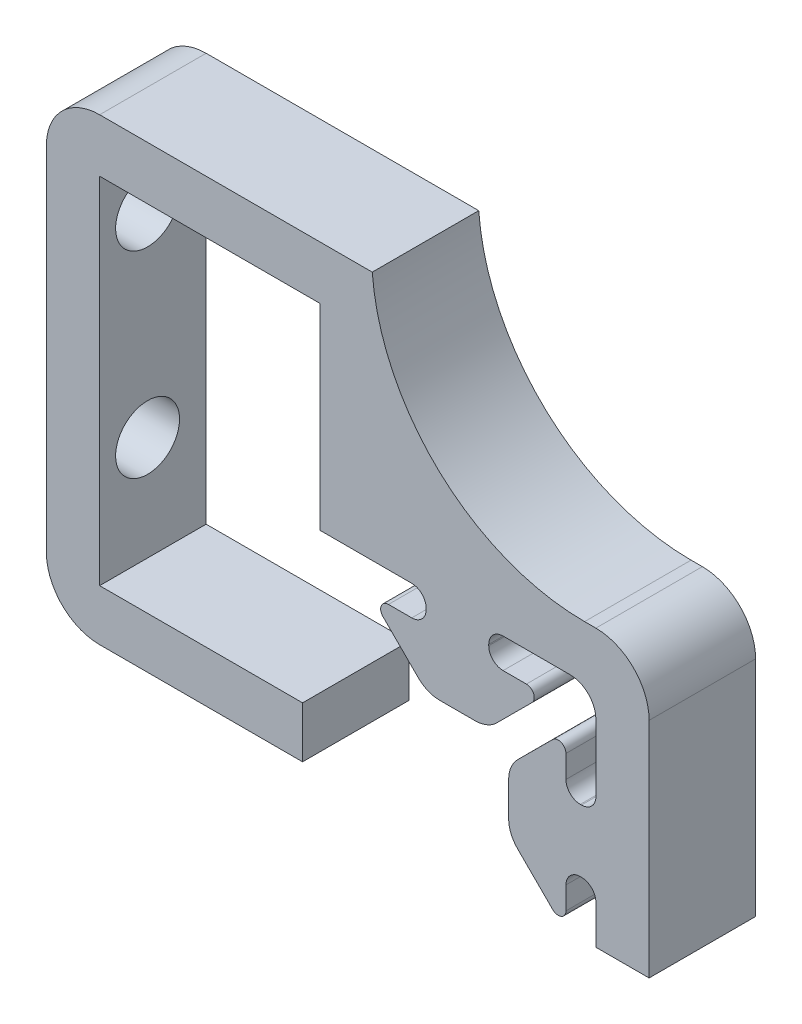
from build123d import *

# Parameters (mm, degrees)
BOSS_EXTRUDE1_DEPTH = 10
CUT_EXTRUDE1_REACH  = 70.061
SKETCH2_R           = 3
FILLET1_R           = 20
FILLET2_R           = 5
SKETCH3_W           = 29.852045942
SKETCH3_H           = 84.66747525
CUT_EXTRUDE2_DEPTH  = 125


with BuildPart() as part:
    # Sketch1 → Boss-Extrude1 (new body)
    with BuildSketch(Plane.XY):
        with BuildLine():
            Line((13, -5.3170836), (13, -7.9544418))
            Line((13, -7.9544418), (18, -7.9544418))
            Line((18, -7.9544418), (18, 18))
            Line((18, 18), (-8, 18))
            Line((-8, 18), (-8, 36.4526666))
            Line((-8, 36.4526666), (-38.6, 36.4526666))
            Line((-38.6, 36.4526666), (-38.6, -6.6473334))
            Line((-38.6, -6.6473334), (-18, -6.6473334))
            Line((-18, -6.6473334), (-14.542097223, -6.6473334))
            Line((-14.542097223, -6.6473334), (-14.542097223, -1.8473334))
            Line((-14.542097223, -1.8473334), (-33.6, -1.8473334))
            Line((-33.6, -1.8473334), (-33.6, 31.4526666))
            Line((-33.6, 31.4526666), (-12.9, 31.4526666))
            Line((-12.9, 31.4526666), (-12.9, 13))
            Line((-12.9, 13), (-4.305880552, 13))
            Line((-4.305880552, 13), (-4.287512407, 13))
            ThreePointArc((-4.287512407, 13), (-3.333616586, 12.604883414), (-2.9385, 11.650987593))
            Line((-2.9385, 11.650987593), (-2.9385, 11.539212407))
            ThreePointArc((-2.9385, 11.539212407), (-3.333616586, 10.585316586), (-4.287512407, 10.1902))
            Line((-4.287512407, 10.1902), (-6.476788598, 10.1902))
            ThreePointArc((-6.476788598, 10.1902), (-7.154992901, 9.736757749), (-6.995146796, 8.93674514))
            Line((-6.995146796, 8.93674514), (-3.686383353, 5.635543623))
            ThreePointArc((-3.686383353, 5.635543623), (-2.754473742, 5.014017446), (-1.655778399, 4.7958))
            Line((-1.655778399, 4.7958), (1.655778399, 4.7958))
            ThreePointArc((1.655778399, 4.7958), (2.754473742, 5.014017446), (3.686383353, 5.635543623))
            Line((3.686383353, 5.635543623), (6.995146796, 8.93674514))
            ThreePointArc((6.995146796, 8.93674514), (7.154992901, 9.736757749), (6.476788598, 10.1902))
            Line((6.476788598, 10.1902), (4.287512407, 10.1902))
            ThreePointArc((4.287512407, 10.1902), (3.333616586, 10.585316586), (2.9385, 11.539212407))
            Line((2.9385, 11.539212407), (2.9385, 11.650987593))
            ThreePointArc((2.9385, 11.650987593), (3.333616586, 12.604883414), (4.287512407, 13))
            Line((4.287512407, 13), (5.321597603, 13))
            Line((5.321597603, 13), (10.5918, 13))
            ThreePointArc((10.5918, 13), (12.29465455, 12.29465455), (13, 10.5918))
            Line((13, 10.5918), (13, 7.9544418))
            Line((13, 7.9544418), (13, 5.3170836))
            Line((13, 5.3170836), (13, 4.287469289))
            ThreePointArc((13, 4.287469289), (12.604883414, 3.333573468), (11.650987593, 2.938456882))
            Line((11.650987593, 2.938456882), (11.539212407, 2.938456882))
            ThreePointArc((11.539212407, 2.938456882), (10.585316586, 3.333573468), (10.1902, 4.287469289))
            Line((10.1902, 4.287469289), (10.1902, 6.402089023))
            ThreePointArc((10.1902, 6.402089023), (9.74154152, 7.073969797), (8.94902056, 6.917034355))
            Line((8.94902056, 6.917034355), (5.652895046, 3.628441884))
            ThreePointArc((5.652895046, 3.628441884), (5.027976112, 2.694919539), (4.8085, 1.593185507))
            Line((4.8085, 1.593185507), (4.8085, -1.593185507))
            ThreePointArc((4.8085, -1.593185507), (5.027976112, -2.694919539), (5.652895046, -3.628441884))
            Line((5.652895046, -3.628441884), (8.94902056, -6.917034355))
            ThreePointArc((8.94902056, -6.917034355), (9.74154152, -7.073969797), (10.1902, -6.402089023))
            Line((10.1902, -6.402089023), (10.1902, -4.287469289))
            ThreePointArc((10.1902, -4.287469289), (10.585316586, -3.333573468), (11.539212407, -2.938456882))
            Line((11.539212407, -2.938456882), (11.650987593, -2.938456882))
            ThreePointArc((11.650987593, -2.938456882), (12.604883414, -3.333573468), (13, -4.287469289))
            Line((13, -4.287469289), (13, -5.3170836))
        make_face()
    extrude(amount=BOSS_EXTRUDE1_DEPTH)

    # Sketch2 → Cut-Extrude1 (cut, up to next)
    with BuildSketch(Plane.ZY.offset(38.6), mode=Mode.PRIVATE) as cut_extrude1_sk1:
        with Locations((4.5, 26.4526666)):
            Circle(SKETCH2_R)
    cut_extrude1_tool1 = extrude(cut_extrude1_sk1.sketch, amount=-CUT_EXTRUDE1_REACH, mode=Mode.PRIVATE) & part.part
    # Sketch2 → Cut-Extrude1 (cut, up to next)
    with BuildSketch(Plane.ZY.offset(38.6), mode=Mode.PRIVATE) as cut_extrude1_sk2:
        with Locations((4.5, 7.9526666)):
            Circle(SKETCH2_R)
    cut_extrude1_tool2 = extrude(cut_extrude1_sk2.sketch, amount=-CUT_EXTRUDE1_REACH, mode=Mode.PRIVATE) & part.part
    add(cut_extrude1_tool1.solids().sort_by_distance((-38.6, 26.452667, 4.5))[0], mode=Mode.SUBTRACT)
    add(cut_extrude1_tool2.solids().sort_by_distance((-38.6, 7.952667, 4.5))[0], mode=Mode.SUBTRACT)

    # Fillet1
    # the kernel refuses this fillet: 20 mm, written as the material it adds along each edge
    with BuildSketch(Plane(origin=(-8, 18, 0), x_dir=(1, 0, 0), z_dir=(0, 0, 1))) as fillet1_piece_1:
        with BuildLine():
            CenterArc((19.940054146, 20), FILLET1_R, 184.437217766, 85.562782234)
            Line((0, 18.4526666), (-0.398801083, 18.421719932))
            ThreePointArc((-0.398801083, 18.421719932), (-0.4, 9.2263333), (-0.4, 0))
            Line((-0.4, 0), (0, -0.4))
            Line((0, -0.4), (19.940054146, -0.4))
            Line((19.940054146, -0.4), (19.940054146, 0))
        make_face()
    extrude(amount=10)

    # Fillet2
    fillet2_edges = [part.edges().sort_by_distance(p)[0] for p in [
        (-38.6, -6.6473334, 5),
        (-38.6, 36.4526666, 5),
        (18, 18, 5),
    ]]
    fillet(fillet2_edges, radius=FILLET2_R)


with BuildPart() as body_2:
    # Mirror1: mirrored copy
    add(part.part.mirror(Plane.XY))


with BuildPart() as part_1:
    add(part.part)

    # Sketch3 → Cut-Extrude2 (cut)
    with BuildSketch(Plane.ZY.offset(38.6)):
        with Locations((14.926022971, 7.66612184)):
            Rectangle(SKETCH3_W, SKETCH3_H)
    extrude(amount=-CUT_EXTRUDE2_DEPTH, mode=Mode.SUBTRACT)


solid = body_2.part
